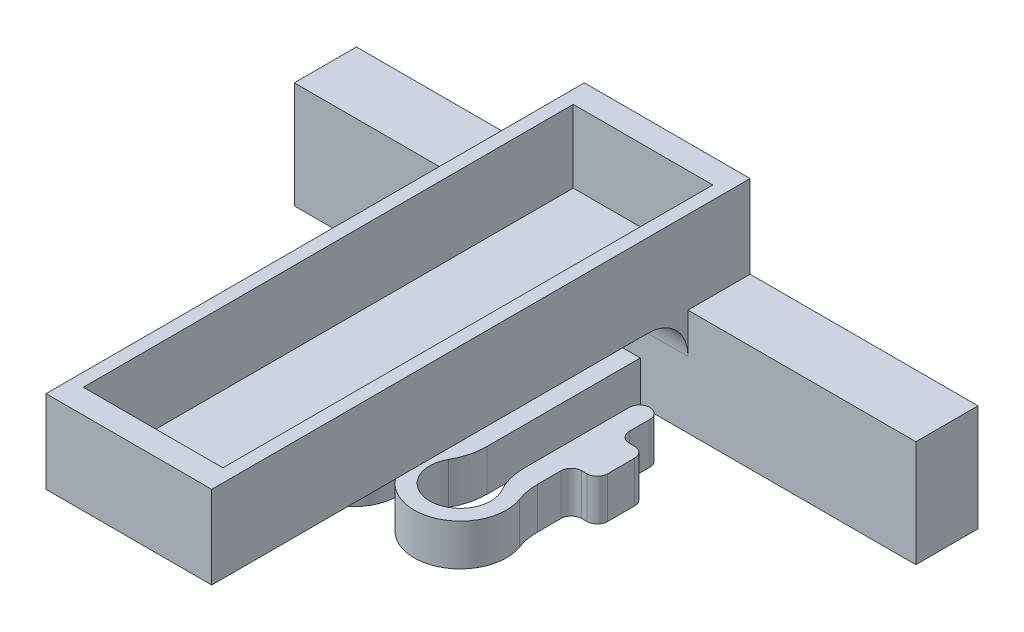
from build123d import *

# Parameters (mm, degrees)
BOSS_EXTRUDE1_DEPTH      = 12.7
BOSS_EXTRUDE1_DEPTH_BACK = 0.364929482
SKETCH1_W                = 76.2
SKETCH1_H                = 7.62
SKETCH14_W               = 38.1
SKETCH14_H               = 7.62
CUT_EXTRUDE5_DEPTH       = 19.558
BOSS_EXTRUDE2_START      = -8
SKETCH15_W               = 2.54
SKETCH15_H               = 21.3868
SKETCH15_W_2             = 3.175
SKETCH15_H_2             = 5.842
BOSS_EXTRUDE2_DEPTH      = 5.08
FILLET1_R                = 7.62
FILLET2_R                = 1.27
SKETCH17_W               = 3.556
SKETCH17_H               = 3.014496912
BOSS_EXTRUDE3_DEPTH      = 5.08
SKETCH18_W               = 20.32
SKETCH18_H               = 66
BOSS_EXTRUDE4_DEPTH      = 10.16
SKETCH19_W               = 17.109306796
SKETCH19_H               = 60.063536248
CUT_EXTRUDE14_DEPTH      = 8.89
FILLET3_R                = 4.92


with BuildPart() as part:
    # Sketch1 → Boss-Extrude1 (new, two sides: drawn at the far end of the back side and taken through both)
    with BuildSketch(Plane(origin=(0, 0, 0), x_dir=(1, 0, 0), z_dir=(0, 1, 0)).offset(-BOSS_EXTRUDE1_DEPTH_BACK)):
        Rectangle(SKETCH1_W, SKETCH1_H)
    extrude(amount=BOSS_EXTRUDE1_DEPTH + BOSS_EXTRUDE1_DEPTH_BACK)

    # Sketch14 → Cut-Extrude5 (cut)
    with BuildSketch(Plane(origin=(0, 12.7, 0), x_dir=(1, 0, 0), z_dir=(0, 1, 0))):
        with Locations((19.05, 0)):
            Rectangle(SKETCH14_W, SKETCH14_H)
    extrude(amount=-CUT_EXTRUDE5_DEPTH, mode=Mode.SUBTRACT)

    # Sketch15 → Boss-Extrude2 (add)
    with BuildSketch(Plane(origin=(0, 12.7, 0), x_dir=(1, 0, 0), z_dir=(0, 1, 0)).offset(BOSS_EXTRUDE2_START)):
        with Locations((-3.048, -14.5034)):
            Rectangle(SKETCH15_W, SKETCH15_H)
        with BuildLine():
            ThreePointArc((-8.89, -25.1968), (-6.604, -31.907368859), (-4.318, -25.1968))
            Line((-4.318, -25.1968), (-1.778, -25.1968))
            ThreePointArc((-1.778, -25.1968), (-6.604, -33.827245709), (-11.43, -25.1968))
            Line((-11.43, -25.1968), (-11.43, -8.4836))
            Line((-11.43, -8.4836), (-8.89, -8.4836))
            Line((-8.89, -8.4836), (-8.89, -25.1968))
        make_face()
        with Locations((-13.0175, -16.4592)):
            Rectangle(SKETCH15_W_2, SKETCH15_H_2)
    extrude(amount=-BOSS_EXTRUDE2_DEPTH)

    # Fillet1
    fillet1_edges = [part.edges().sort_by_distance(p)[0] for p in [
        (-11.43, 2.16, 25.1968),
        (-1.778, 2.16, 25.1968),
        (-8.89, 2.16, 25.1968),
        (-4.318, 2.16, 25.1968),
    ]]
    fillet(fillet1_edges, radius=FILLET1_R)

    # Fillet2
    fillet2_edges = [part.edges().sort_by_distance(p)[0] for p in [
        (-11.43, 2.16, 19.3802),
        (-14.605, 2.16, 19.3802),
        (-14.605, 2.16, 13.5382),
        (-11.43, 2.16, 13.5382),
        (-8.89, 2.16, 8.4836),
        (-11.43, 2.16, 8.4836),
    ]]
    fillet(fillet2_edges, radius=FILLET2_R - 0.0001)  # a hair under: the kernel refuses the full size

    # Mirror1: part across plane


with BuildPart() as part_1:
    add(part.part)
    add(part.part.mirror(Plane(origin=(0, -6.858, -3.81), x_dir=(0, 0, 1), z_dir=(-1, 0, 0))))

    # Sketch17 → Boss-Extrude3 (add)
    with BuildSketch(Plane(origin=(0, 4.7, 0), x_dir=(1, 0, 0), z_dir=(0, 1, 0))):
        with Locations((0, -8.490791694)):
            Rectangle(SKETCH17_W, SKETCH17_H)
        with Locations((0, -18.593429993)):
            Rectangle(SKETCH17_W, SKETCH17_H)
    extrude(amount=-BOSS_EXTRUDE3_DEPTH)

    # Sketch18 → Boss-Extrude4 (add)
    with BuildSketch(Plane(origin=(0, 12.7, 0), x_dir=(1, 0, 0), z_dir=(0, 1, 0))):
        with Locations((0, -29.19)):
            Rectangle(SKETCH18_W, SKETCH18_H)
    extrude(amount=BOSS_EXTRUDE4_DEPTH)

    # Sketch19 → Cut-Extrude14 (cut)
    with BuildSketch(Plane(origin=(0, 22.86, 0), x_dir=(1, 0, 0), z_dir=(0, 1, 0))):
        with Locations((0, -29.19)):
            Rectangle(SKETCH19_W, SKETCH19_H)
    extrude(amount=-CUT_EXTRUDE14_DEPTH, mode=Mode.SUBTRACT)

    # Fillet3
    fillet3_edges = [part_1.edges().sort_by_distance(p)[0] for p in [
        (0, 12.7, 3.81),
    ]]
    fillet(fillet3_edges, radius=FILLET3_R)


solid = part_1.part
